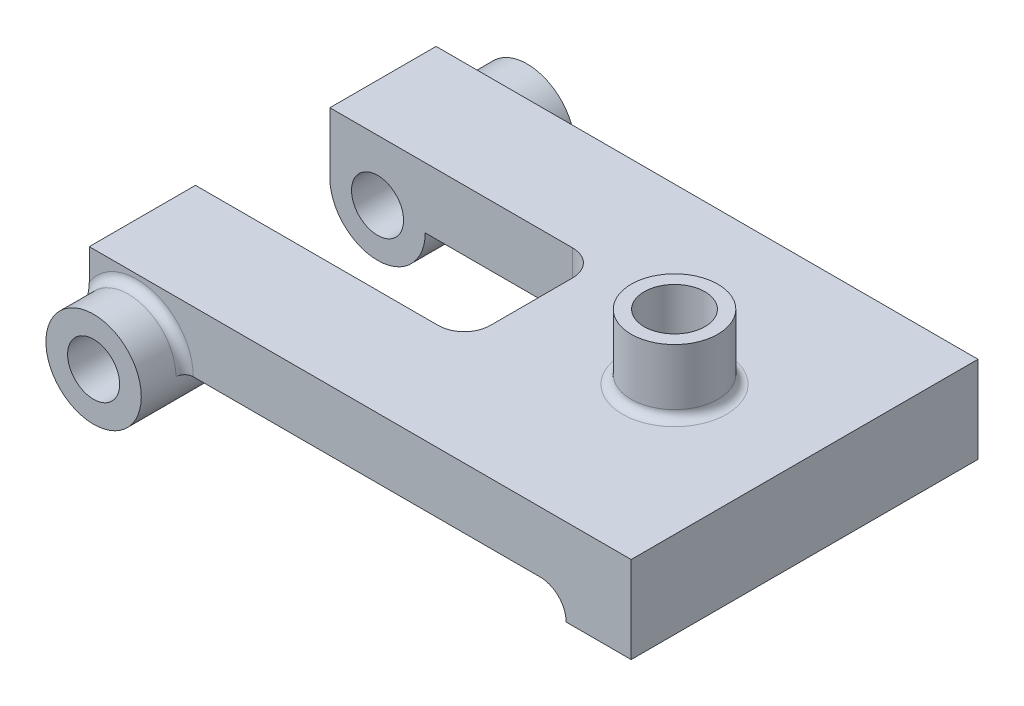
from build123d import *

# Parameters (mm, degrees)
SKETCH1_R           = 6
BOSS_EXTRUDE1_DEPTH = 40
BOSS_EXTRUDE2_DEPTH = 50
SKETCH2_W           = 62
SKETCH2_H           = 31
CUT_EXTRUDE1_DEPTH  = 137.930639376
SKETCH3_R           = 7
CUT_EXTRUDE2_DEPTH  = 137.930639376
BOSS_EXTRUDE3_START = 15
SKETCH3_3_R         = 10
SKETCH3_3_R_2       = 7
BOSS_EXTRUDE3_DEPTH = 15
FILLET1_R           = 6
FILLET2_R           = 2


with BuildPart() as part:
    # Sketch1 → Boss-Extrude1 (new, symmetric)
    with BuildSketch(Plane.XY):
        with BuildLine():
            Line((22, 0), (104, 0))
            ThreePointArc((104, 0), (108.242640687, -1.757359313), (110, -6))
            Line((110, -6), (125, -6))
            Line((125, -6), (125, 14))
            Line((125, 14), (0, 14))
            Line((0, 14), (0, 0))
            ThreePointArc((0, 0), (11, -11), (22, 0))
        make_face()
        with Locations((11, 0)):
            Circle(SKETCH1_R, mode=Mode.SUBTRACT)
    extrude(amount=BOSS_EXTRUDE1_DEPTH, both=True)

    # Sketch1<3> → Boss-Extrude2 (add, symmetric)
    with BuildSketch(Plane.XY):
        with BuildLine():
            ThreePointArc((22, 0), (11, 11), (0, 0))
            Line((0, 0), (5, 0))
            ThreePointArc((5, 0), (11, 6), (17, 0))
            Line((17, 0), (22, 0))
        make_face()
        with BuildLine():
            Line((5, 0), (0, 0))
            ThreePointArc((0, 0), (11, -11), (22, 0))
            Line((22, 0), (17, 0))
            ThreePointArc((17, 0), (11, -6), (5, 0))
        make_face()
    extrude(amount=BOSS_EXTRUDE2_DEPTH, both=True)

    # Sketch2 → Cut-Extrude1 (cut, through all)
    with BuildSketch(Plane(origin=(0, 14, 0), x_dir=(1, 0, 0), z_dir=(0, 1, 0))):
        with Locations((31, 0)):
            Rectangle(SKETCH2_W, SKETCH2_H)
    extrude(amount=-CUT_EXTRUDE1_DEPTH, mode=Mode.SUBTRACT)

    # Sketch3 → Cut-Extrude2 (cut, through all)
    with BuildSketch(Plane(origin=(0, 14, 0), x_dir=(1, 0, 0), z_dir=(0, 1, 0))):
        with Locations(Location((95, 0, 0), (0, 0, 270))):
            Circle(SKETCH3_R)
    extrude(amount=-CUT_EXTRUDE2_DEPTH, mode=Mode.SUBTRACT)

    # Sketch3<3> → Boss-Extrude3 (add)
    with BuildSketch(Plane(origin=(0, 14, 0), x_dir=(1, 0, 0), z_dir=(0, 1, 0)).offset(BOSS_EXTRUDE3_START)):
        with Locations(Location((95, 0, 0), (0, 0, 270))):
            Circle(SKETCH3_3_R)
        with Locations(Location((95, 0, 0), (0, 0, 270))):
            Circle(SKETCH3_3_R_2, mode=Mode.SUBTRACT)
    extrude(amount=-BOSS_EXTRUDE3_DEPTH)

    # Fillet1
    fillet1_edges = [part.edges().sort_by_distance(p)[0] for p in [
        (62, 7, 15.5),
        (62, 7, -15.5),
    ]]
    fillet(fillet1_edges, radius=FILLET1_R)

    # Fillet2
    # the kernel refuses this fillet: 2 mm, written as the material it adds along each edge
    with BuildSketch(Plane(origin=(11, 0, -40), x_dir=(1, 0, 0), z_dir=(0, -1, 0))) as fillet2_piece_1_section:
        with BuildLine():
            CenterArc((11 + FILLET2_R, -FILLET2_R), FILLET2_R, 90, 90)
            Line((11 + FILLET2_R, 0), (11, 0))
            Line((11, 0), (11, -FILLET2_R))
        make_face()
    fillet2_piece_1 = revolve(axis=Axis((11, 0, -40), (0, 0, 1)), revolution_arc=180, mode=Mode.PRIVATE)
    fillet2_piece_1 = split(fillet2_piece_1, bisect_by=Plane(origin=(0, 11.564222142, -40.564222142), z_dir=(1, 0, 0)), keep=Keep.TOP, mode=Mode.PRIVATE)
    add(fillet2_piece_1)
    with BuildSketch(Plane(origin=(11, 0, 40), x_dir=(1, 0, 0), z_dir=(0, -1, 0))) as fillet2_piece_2_section:
        with BuildLine():
            CenterArc((11 + FILLET2_R, FILLET2_R), FILLET2_R, 180, 90)
            Line((11, FILLET2_R), (11, 0))
            Line((11, 0), (11 + FILLET2_R, 0))
        make_face()
    fillet2_piece_2 = revolve(axis=Axis((11, 0, 40), (0, 0, 1)), revolution_arc=180, mode=Mode.PRIVATE)
    fillet2_piece_2 = split(fillet2_piece_2, bisect_by=Plane(origin=(0, 11.564222139, 40.564222139), z_dir=(1, 0, 0)), keep=Keep.TOP, mode=Mode.PRIVATE)
    add(fillet2_piece_2)
    with BuildSketch(Plane(origin=(95, 14, 0), x_dir=(0, 0, 1), z_dir=(-1, 0, 0))) as fillet2_piece_3:
        with BuildLine():
            CenterArc((10 + FILLET2_R, FILLET2_R), FILLET2_R, 180, 90)
            Line((10, FILLET2_R), (10, 0))
            Line((10, 0), (10 + FILLET2_R, 0))
        make_face()
    revolve(axis=Axis((95, 14, 0), (0, 1, 0)))


solid = part.part
